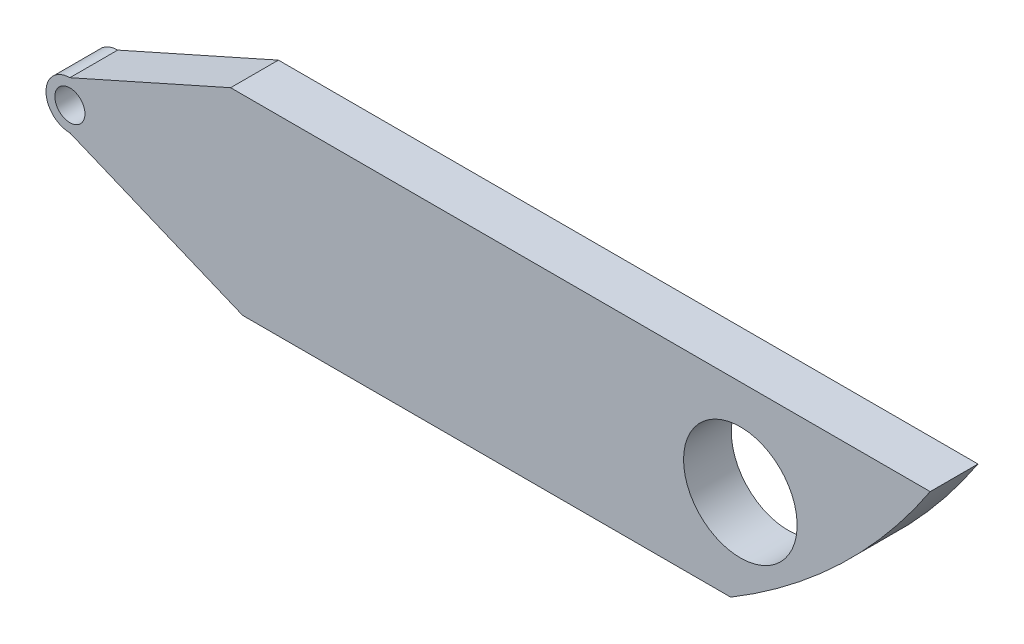
from build123d import *

# Parameters (mm, degrees)
SKETCH1_W           = 241.3
SKETCH1_H           = 50.8
BOSS_EXTRUDE1_DEPTH = 12.7
SKETCH3_R           = 4
CUT_EXTRUDE1_DEPTH  = 124.947055229
CUT_EXTRUDE2_DEPTH  = 124.947055229
SKETCH11_R          = 15.09
CUT_EXTRUDE3_DEPTH  = 124.947055229


with BuildPart() as part:
    # Sketch1 → Boss-Extrude1 (new body)
    with BuildSketch(Plane.XY):
        Rectangle(SKETCH1_W, SKETCH1_H)
    extrude(amount=BOSS_EXTRUDE1_DEPTH)

    # Sketch3 → Cut-Extrude1 (cut, through all)
    with BuildSketch(Plane.XY.offset(12.7)):
        with Locations((-107.95, 0)):
            Circle(SKETCH3_R)
    extrude(amount=-CUT_EXTRUDE1_DEPTH, mode=Mode.SUBTRACT)

    # Sketch5 → Cut-Extrude2 (cut, through all)
    with BuildSketch(Plane.XY.offset(12.7)):
        with BuildLine():
            Line((-62.046109456, -25.4), (-107.95, -6.35))
            ThreePointArc((-107.95, -6.35), (-114.3, 0), (-107.95, 6.35))
            Line((-107.95, 6.35), (-65.239311186, 25.4))
            Line((-65.239311186, 25.4), (-120.65, 25.4))
            Line((-120.65, 25.4), (-120.65, -25.4))
            Line((-120.65, -25.4), (-62.046109456, -25.4))
        make_face()
        with BuildLine():
            ThreePointArc((120.65, 25.4), (97.003321964, -2.984354021), (67.637087091, -25.4))
            Line((67.637087091, -25.4), (120.65, -25.4))
            Line((120.65, -25.4), (120.65, 25.4))
        make_face()
    extrude(amount=-CUT_EXTRUDE2_DEPTH, mode=Mode.SUBTRACT)

    # Sketch11 → Cut-Extrude3 (cut, through all)
    with BuildSketch(Plane(origin=(0, 0, 0), x_dir=(-1, 0, 0), z_dir=(0, 0, -1))):
        with Locations((-70.2, 0)):
            Circle(SKETCH11_R)
    extrude(amount=-CUT_EXTRUDE3_DEPTH, mode=Mode.SUBTRACT)


solid = part.part
